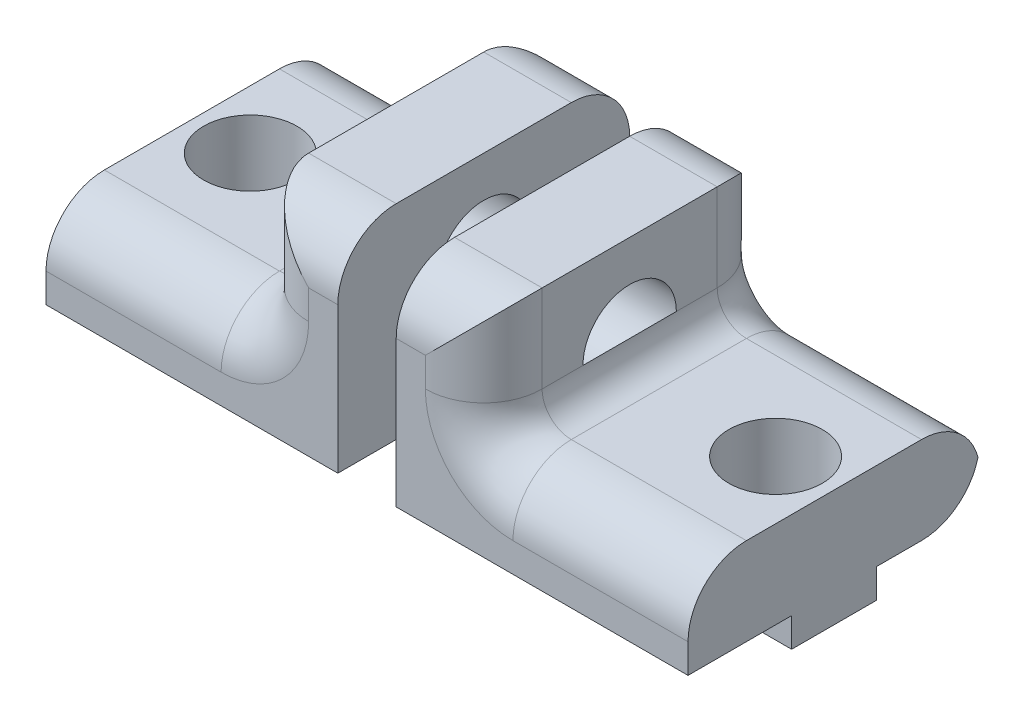
from build123d import *

# Parameters (mm, degrees)
MAIN_DEPTH               = 5
VERTICALHOLE_DEPTH       = 14.190905958
VERTICALHOLE_DEPTH_BACK  = 3
ESQUISSE2_R              = 1.6
ESQUISSE5_W              = 10
ESQUISSE5_H              = 2.9
MAKERBEAMSUPPORT_DEPTH   = 1
MAKERBEAMHOLE_DEPTH      = 14.190905958
MAKERBEAMHOLE_DEPTH_BACK = 14.190905958
ESQUISSE3_R              = 1.6
FILLET1_R                = 2


with BuildPart() as part:
    # Esquisse1 → Main (new, symmetric)
    with BuildSketch(Plane.XY):
        with BuildLine():
            Line((0, 0), (10, 0))
            Line((10, 0), (10, 3))
            Line((10, 3), (4, 3))
            ThreePointArc((4, 3), (3.292893219, 3.292893219), (3, 4))
            Line((3, 4), (3, 7))
            Line((3, 7), (0, 7))
            Line((0, 7), (0, 0))
        make_face()
    extrude(amount=MAIN_DEPTH, both=True)

    # Esquisse2 → VerticalHole (cut, two sides: drawn at the far end of the back side and taken through both)
    with BuildSketch(Plane.ZY.offset(-VERTICALHOLE_DEPTH_BACK)):
        with Locations(Location((0, 4, 0), (0, 0, 180))):
            Circle(ESQUISSE2_R)
    extrude(amount=VERTICALHOLE_DEPTH + VERTICALHOLE_DEPTH_BACK, mode=Mode.SUBTRACT)

    # Esquisse5 → MakerBeamSupport (add)
    with BuildSketch(Plane(origin=(0, 0, 0), x_dir=(-1, 0, 0), z_dir=(0, -1, 0))):
        with Locations((-5, 0)):
            Rectangle(ESQUISSE5_W, ESQUISSE5_H)
    extrude(amount=MAKERBEAMSUPPORT_DEPTH)

    # Esquisse3 → MakerBeamHole (cut, two sides: drawn at the far end of the back side and taken through both)
    with BuildSketch(Plane.XZ.offset(-MAKERBEAMHOLE_DEPTH_BACK)):
        with Locations(Location((8, 0, 0), (0, 0, 244.992166765))):
            Circle(ESQUISSE3_R)
    extrude(amount=MAKERBEAMHOLE_DEPTH + MAKERBEAMHOLE_DEPTH_BACK, mode=Mode.SUBTRACT)

    # Fillet1
    # the kernel refuses this fillet: 2 mm, written as the material it takes off along each edge
    with BuildSketch(Plane(origin=(3, 4, -5), x_dir=(-1, 0, 0), z_dir=(0, 1, 0))) as fillet1_piece_1:
        with BuildLine():
            CenterArc((FILLET1_R, FILLET1_R), FILLET1_R, 180, 90)
            Line((0, FILLET1_R), (0, 0))
            Line((0, 0), (FILLET1_R, 0))
        make_face()
    extrude(amount=8, mode=Mode.SUBTRACT)
    with BuildSketch(Plane(origin=(4, 4, -5), x_dir=(0, -1, 0), z_dir=(1, 0, 0))) as fillet1_piece_2:
        with BuildLine():
            CenterArc((1 + FILLET1_R, -FILLET1_R), FILLET1_R, 90, 90)
            Line((1, -FILLET1_R), (1, 0))
            Line((1, 0), (1 + FILLET1_R, 0))
        make_face()
    revolve(axis=Axis((4, 4, -5), (0, 0, -1)), revolution_arc=90, mode=Mode.SUBTRACT)
    with BuildSketch(Plane(origin=(3, 4, 5), x_dir=(-1, 0, 0), z_dir=(0, 1, 0))) as fillet1_piece_3:
        with BuildLine():
            CenterArc((FILLET1_R, -FILLET1_R), FILLET1_R, 90, 90)
            Line((0, -FILLET1_R), (0, 0))
            Line((0, 0), (FILLET1_R, 0))
        make_face()
    extrude(amount=8, mode=Mode.SUBTRACT)
    with BuildSketch(Plane(origin=(4, 4, 5), x_dir=(0, -1, 0), z_dir=(1, 0, 0))) as fillet1_piece_4:
        with BuildLine():
            CenterArc((1 + FILLET1_R, FILLET1_R), FILLET1_R, 180, 90)
            Line((1, FILLET1_R), (1, 0))
            Line((1, 0), (1 + FILLET1_R, 0))
        make_face()
    revolve(axis=Axis((4, 4, 5), (0, 0, -1)), revolution_arc=90, mode=Mode.SUBTRACT)
    with BuildSketch(Plane(origin=(15, 3, -5), x_dir=(0, -1, 0), z_dir=(-1, 0, 0)), Plane(origin=(15, 3, 5), x_dir=(0, 0, -1), z_dir=(-1, 0, 0))) as fillet1_piece_5:
        with BuildLine():
            CenterArc((FILLET1_R, FILLET1_R), FILLET1_R, 180, 90)
            Line((0, FILLET1_R), (0, 0))
            Line((0, 0), (FILLET1_R, 0))
        make_face()
    extrude(amount=11, mode=Mode.SUBTRACT)
    with BuildSketch(Plane(origin=(8, 7, -5), x_dir=(0, -1, 0), z_dir=(-1, 0, 0))) as fillet1_piece_6:
        with BuildLine():
            CenterArc((FILLET1_R, FILLET1_R), FILLET1_R, 180, 90)
            Line((0, FILLET1_R), (0, 0))
            Line((0, 0), (FILLET1_R, 0))
        make_face()
    extrude(amount=13, mode=Mode.SUBTRACT)
    with BuildSketch(Plane(origin=(8, 7, 5), x_dir=(0, -1, 0), z_dir=(-1, 0, 0))) as fillet1_piece_7:
        with BuildLine():
            CenterArc((FILLET1_R, -FILLET1_R), FILLET1_R, 90, 90)
            Line((0, -FILLET1_R), (0, 0))
            Line((0, 0), (FILLET1_R, 0))
        make_face()
    extrude(amount=13, mode=Mode.SUBTRACT)
    with BuildSketch(Plane(origin=(-5, 0, -5), x_dir=(0, 0, 1), z_dir=(1, 0, 0))) as fillet1_piece_8:
        with BuildLine():
            CenterArc((FILLET1_R, -FILLET1_R), FILLET1_R, 90, 90)
            Line((0, -FILLET1_R), (0, 0))
            Line((0, 0), (FILLET1_R, 0))
        make_face()
    extrude(amount=20, mode=Mode.SUBTRACT)


with BuildPart() as body_2:
    # Mirror2: mirrored copy
    add(part.part.mirror(Plane.ZY.offset(1)))


solid = Compound([part.part, body_2.part])
